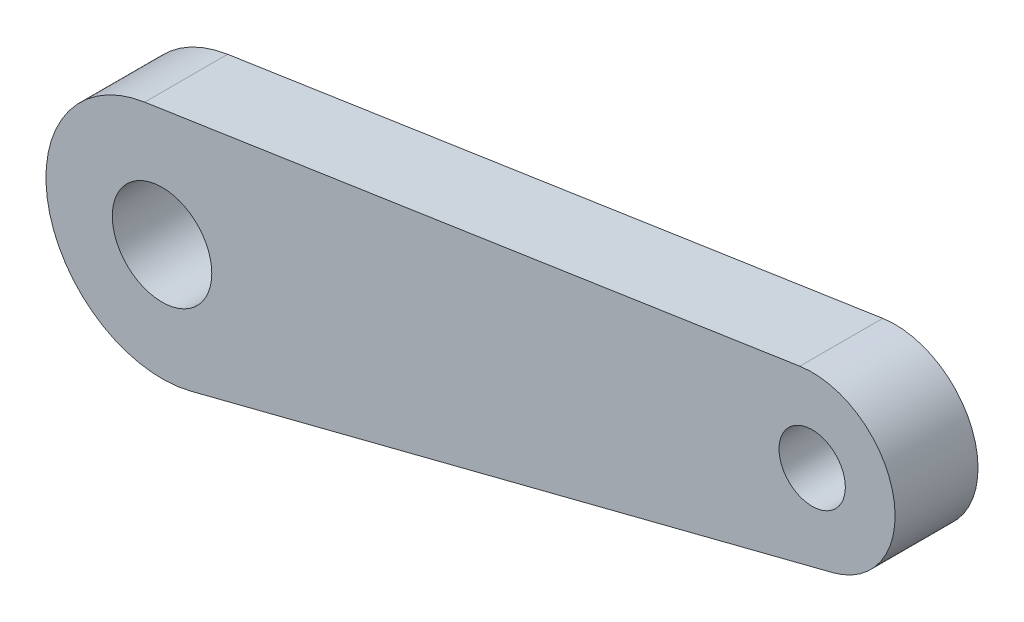
from build123d import *

# Parameters (mm, degrees)
BOSS_EXTRUDE1_START = 10
SKETCH1_R           = 3
SKETCH1_R_2         = 2
BOSS_EXTRUDE1_DEPTH = 5


with BuildPart() as part:
    # Sketch1 → Boss-Extrude1 (new body)
    with BuildSketch(Plane.XY.offset(BOSS_EXTRUDE1_START)):
        with BuildLine():
            Line((-51.044527949, 24.921629964), (-11.541827876, 30.882895517))
            ThreePointArc((-11.541827876, 30.882895517), (-5.895203545, 26.931233378), (-9.559591798, 21.094088637))
            Line((-9.559591798, 21.094088637), (-48.26939744, 11.217300333))
            ThreePointArc((-48.26939744, 11.217300333), (-56.860746115, 16.61069703), (-51.044527949, 24.921629964))
        make_face()
        with Locations((-50, 18)):
            Circle(SKETCH1_R, mode=Mode.SUBTRACT)
        with Locations((-10.795736484, 25.938874114)):
            Circle(SKETCH1_R_2, mode=Mode.SUBTRACT)
    extrude(amount=BOSS_EXTRUDE1_DEPTH)


solid = part.part
